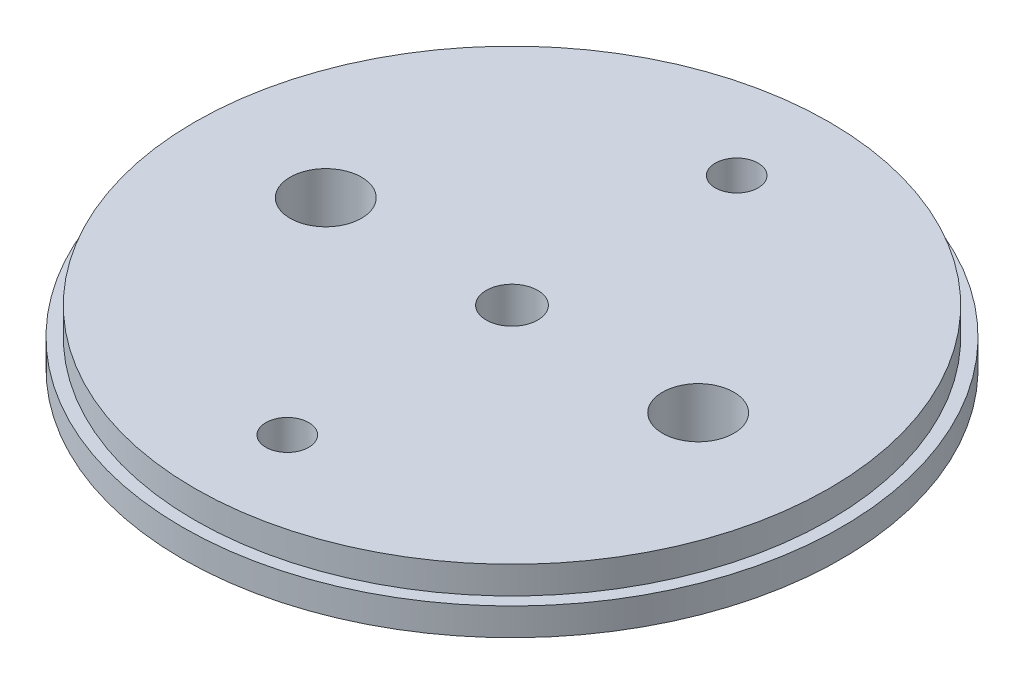
from build123d import *

# Parameters (mm, degrees)
SKETCH1_R           = 76.1746
BOSS_EXTRUDE1_DEPTH = 6.35
SKETCH1_3_R         = 73.3425
BOSS_EXTRUDE2_DEPTH = 12.7
SKETCH3_R           = 5.953125
SKETCH3_R_2         = 8.250047
SKETCH3_R_3         = 4.9609375
CUT_EXTRUDE1_DEPTH  = 109.473173505


with BuildPart() as part:
    # Sketch1 → Boss-Extrude1 (new body)
    with BuildSketch(Plane(origin=(0, 0, 0), x_dir=(1, 0, 0), z_dir=(0, 1, 0))):
        Circle(SKETCH1_R)
    extrude(amount=BOSS_EXTRUDE1_DEPTH)

    # Sketch1<3> → Boss-Extrude2 (add)
    with BuildSketch(Plane(origin=(0, 0, 0), x_dir=(1, 0, 0), z_dir=(0, 1, 0))):
        Circle(SKETCH1_3_R)
    extrude(amount=BOSS_EXTRUDE2_DEPTH)

    # Sketch3 → Cut-Extrude1 (cut, through all)
    with BuildSketch(Plane.XZ):
        Circle(SKETCH3_R)
        with Locations((-43.038165324, 0)):
            Circle(SKETCH3_R_2)
        with Locations((43.038165324, 0)):
            Circle(SKETCH3_R_2)
        with Locations((0, 51.933318491)):
            Circle(SKETCH3_R_3)
        with Locations((0, -51.933318491)):
            Circle(SKETCH3_R_3)
    extrude(amount=-CUT_EXTRUDE1_DEPTH, mode=Mode.SUBTRACT)


solid = part.part
